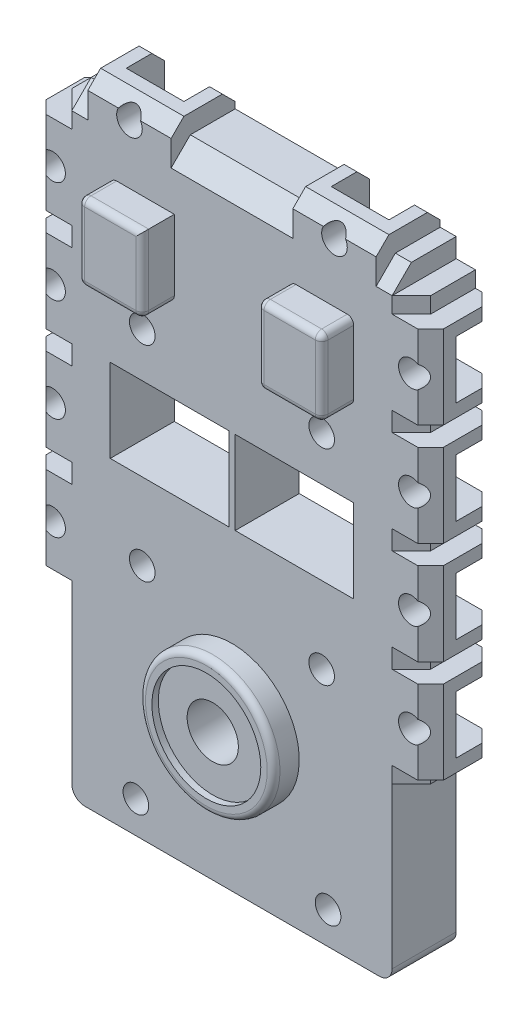
from build123d import *

# Parameters (mm, degrees)
BOSS_EXTRUDE1_DEPTH       = 5
BOSS_EXTRUDE2_DEPTH       = 1
SKETCH3_R                 = 5.25
SKETCH3_R_2               = 2
BOSS_EXTRUDE3_DEPTH       = 2
SKETCH4_R                 = 4.25
CUT_EXTRUDE1_DEPTH        = 0.5
FILLET3_R                 = 0.5
CUT_EXTRUDE2_START        = -11.5
SKETCH5_R                 = 2
CUT_EXTRUDE2_DEPTH        = 11.5
SKETCH6_W                 = 1.5
SKETCH6_H                 = 33
BOSS_EXTRUDE4_DEPTH       = 5
CUT_EXTRUDE3_DEPTH        = 61
SKETCH8_W                 = 3
SKETCH8_H                 = 6.5
SKETCH8_R                 = 1
BOSS_EXTRUDE5_DEPTH       = 5
CUT_EXTRUDE4_DEPTH        = 31
SKETCH10_R                = 1
CUT_EXTRUDE5_DEPTH        = 31
BOSS_EXTRUDE11_DEPTH      = 5
CUT_EXTRUDE6_DEPTH        = 25
SKETCH13_W                = 6.5
SKETCH13_H                = 3
SKETCH13_R                = 1
BOSS_EXTRUDE12_DEPTH      = 5
SKETCH15_R                = 1
CUT_EXTRUDE7_DEPTH        = 5
CUT_EXTRUDE8_DEPTH        = 23
CUT_EXTRUDE10_START       = -3
CUT_EXTRUDE10_OUTLINE_W   = 4.5
CUT_EXTRUDE10_OUTLINE_H   = 3
CUT_EXTRUDE10_OUTLINE_H_2 = 2
CUT_EXTRUDE10_DEPTH       = 3
SKETCH18_W                = 3
SKETCH18_H                = 4.5
CUT_EXTRUDE11_DEPTH       = 3
SKETCH19_W                = 4.5
SKETCH19_H                = 1
CUT_EXTRUDE12_DEPTH       = 3
SKETCH20_W                = 1
SKETCH20_H                = 4.5
SKETCH20_W_2              = 3
CUT_EXTRUDE13_DEPTH       = 3
SKETCH21_W                = 5
SKETCH21_H                = 6
BOSS_EXTRUDE13_DEPTH      = 2.5
FILLET4_R                 = 0.5
SKETCH22_R                = 1
SKETCH22_W                = 9.25
SKETCH22_H                = 6.5
CUT_EXTRUDE14_DEPTH       = 14.5


# Read off the part's stored shape, not the designer's step: Cut-Extrude10
with BuildPart() as part:
    # Sketch1 → Boss-Extrude1 (new body)
    with BuildSketch(Plane.XY):
        with BuildLine():
            Line((18.25, 1.5), (18.25, 0))
            Line((18.25, 0), (24, 0))
            ThreePointArc((24, 0), (24.707106781, -0.292893219), (25, -1))
            Line((25, -1), (25, -45.5))
            ThreePointArc((25, -45.5), (24.707106781, -46.207106781), (24, -46.5))
            Line((24, -46.5), (1, -46.5))
            ThreePointArc((1, -46.5), (0.292893219, -46.207106781), (0, -45.5))
            Line((0, -45.5), (0, -1))
            ThreePointArc((0, -1), (0.292893219, -0.292893219), (1, 0))
            Line((1, 0), (6.75, 0))
            Line((6.75, 0), (6.75, 1.5))
            Line((6.75, 1.5), (18.25, 1.5))
        make_face()
    extrude(amount=BOSS_EXTRUDE1_DEPTH)

    # Sketch2 → Boss-Extrude2 (add)
    with BuildSketch(Plane(origin=(0, 0, 0), x_dir=(-1, 0, 0), z_dir=(0, 0, -1))):
        with BuildLine():
            Line((-24, -2), (-24, -44.5))
            ThreePointArc((-24, -44.5), (-23.707106781, -45.207106781), (-23, -45.5))
            Line((-23, -45.5), (-2, -45.5))
            ThreePointArc((-2, -45.5), (-1.292893219, -45.207106781), (-1, -44.5))
            Line((-1, -44.5), (-1, -2))
            ThreePointArc((-1, -2), (-1.292893219, -1.292893219), (-2, -1))
            Line((-2, -1), (-23, -1))
            ThreePointArc((-23, -1), (-23.707106781, -1.292893219), (-24, -2))
        make_face()
        with BuildLine():
            Line((-23, -3), (-23, -43.5))
            ThreePointArc((-23, -43.5), (-22.707106781, -44.207106781), (-22, -44.5))
            Line((-22, -44.5), (-3, -44.5))
            ThreePointArc((-3, -44.5), (-2.292893219, -44.207106781), (-2, -43.5))
            Line((-2, -43.5), (-2, -3))
            ThreePointArc((-2, -3), (-2.292893219, -2.292893219), (-3, -2))
            Line((-3, -2), (-22, -2))
            ThreePointArc((-22, -2), (-22.707106781, -2.292893219), (-23, -3))
        make_face(mode=Mode.SUBTRACT)
    extrude(amount=BOSS_EXTRUDE2_DEPTH)

    # Sketch3 → Boss-Extrude3 (add)
    with BuildSketch(Plane.XY.offset(5)):
        with Locations(Location((12.5, -35, 0), (0, 0, 180))):
            Circle(SKETCH3_R)
        with Locations((12.5, -35)):
            Circle(SKETCH3_R_2, mode=Mode.SUBTRACT)
    extrude(amount=BOSS_EXTRUDE3_DEPTH)

    # Sketch4 → Cut-Extrude1 (cut)
    with BuildSketch(Plane.XY.offset(7)):
        with Locations((12.5, -35)):
            Circle(SKETCH4_R)
    extrude(amount=-CUT_EXTRUDE1_DEPTH, mode=Mode.SUBTRACT)

    # Fillet3
    fillet3_edges = [part.edges().sort_by_distance(p)[0] for p in [
        (17.75, -35, 7),
    ]]
    fillet(fillet3_edges, radius=FILLET3_R)

    # Sketch5 → Cut-Extrude2 (cut)
    with BuildSketch(Plane.XY.offset(5).offset(CUT_EXTRUDE2_START)):
        with Locations(Location((12.5, -35, 0), (0, 0, 180))):
            Circle(SKETCH5_R)
    extrude(amount=CUT_EXTRUDE2_DEPTH, mode=Mode.SUBTRACT)

    # Sketch6 → Boss-Extrude4 (add)
    with BuildSketch(Plane.XY.offset(5)):
        with Locations((25.75, -16.5)):
            Rectangle(SKETCH6_W, SKETCH6_H)
        with Locations((-0.75, -16.5)):
            Rectangle(SKETCH6_W, SKETCH6_H)
    extrude(amount=-BOSS_EXTRUDE4_DEPTH)

    # Sketch7 → Cut-Extrude3 (cut)
    with BuildSketch(Plane(origin=(0, 0, 0), x_dir=(-1, 0, 0), z_dir=(0, 1, 0))):
        Polygon((-26.5, 3.5), (-25, 5), (-26.5, 5), align=None)
        Polygon((1.5, 3.5), (0, 5), (1.5, 5), align=None)
    extrude(amount=-CUT_EXTRUDE3_DEPTH, mode=Mode.SUBTRACT)

    # Sketch8 → Boss-Extrude5 (add)
    # profile 1 of 8: a face of its own
    with BuildSketch(Plane.XY.offset(5)):
        with Locations((26.5, -28.5)):
            Rectangle(SKETCH8_W, SKETCH8_H)
        with Locations((26.5, -28.5)):
            Circle(SKETCH8_R, mode=Mode.SUBTRACT)
    # profile 2 of 8: a face of its own
    with BuildSketch(Plane.XY.offset(5)):
        with Locations((26.5, -20.5)):
            Rectangle(SKETCH8_W, SKETCH8_H)
        with Locations((26.5, -20.5)):
            Circle(SKETCH8_R, mode=Mode.SUBTRACT)
    # profile 3 of 8: a face of its own
    with BuildSketch(Plane.XY.offset(5)):
        with Locations((26.5, -12.5)):
            Rectangle(SKETCH8_W, SKETCH8_H)
        with Locations((26.5, -12.5)):
            Circle(SKETCH8_R, mode=Mode.SUBTRACT)
    # profile 4 of 8: a face of its own
    with BuildSketch(Plane.XY.offset(5)):
        with Locations((26.5, -4.5)):
            Rectangle(SKETCH8_W, SKETCH8_H)
        with Locations((26.5, -4.5)):
            Circle(SKETCH8_R, mode=Mode.SUBTRACT)
    # profile 5 of 8: a face of its own
    with BuildSketch(Plane.XY.offset(5)):
        with Locations((-1.5, -4.5)):
            Rectangle(SKETCH8_W, SKETCH8_H)
        with Locations(Location((-1.5, -4.5, 0), (0, 0, 90))):
            Circle(SKETCH8_R, mode=Mode.SUBTRACT)
    # profile 6 of 8: a face of its own
    with BuildSketch(Plane.XY.offset(5)):
        with Locations((-1.5, -12.5)):
            Rectangle(SKETCH8_W, SKETCH8_H)
        with Locations(Location((-1.5, -12.5, 0), (0, 0, 90))):
            Circle(SKETCH8_R, mode=Mode.SUBTRACT)
    # profile 7 of 8: a face of its own
    with BuildSketch(Plane.XY.offset(5)):
        with Locations((-1.5, -20.5)):
            Rectangle(SKETCH8_W, SKETCH8_H)
        with Locations(Location((-1.5, -20.5, 0), (0, 0, 90))):
            Circle(SKETCH8_R, mode=Mode.SUBTRACT)
    # profile 8 of 8: a face of its own
    with BuildSketch(Plane.XY.offset(5)):
        with Locations((-1.5, -28.5)):
            Rectangle(SKETCH8_W, SKETCH8_H)
        with Locations(Location((-1.5, -28.5, 0), (0, 0, 90))):
            Circle(SKETCH8_R, mode=Mode.SUBTRACT)
    extrude(amount=-BOSS_EXTRUDE5_DEPTH)

    # Sketch9 → Cut-Extrude4 (cut)
    with BuildSketch(Plane(origin=(0, -1.25, 0), x_dir=(-1, 0, 0), z_dir=(0, 1, 0))):
        Polygon((2, 5), (3, 4), (3, 5), align=None)
        Polygon((3, 1), (3, 0), (2, 0), align=None)
        Polygon((-27, 0), (-28, 0), (-28, 1), align=None)
        Polygon((-27, 5), (-28, 5), (-28, 4), align=None)
    extrude(amount=-CUT_EXTRUDE4_DEPTH, mode=Mode.SUBTRACT)

    # Sketch10 → Cut-Extrude5 (cut)
    with BuildSketch(Plane.XY.offset(5)):
        with Locations(Location((26.5, -28.5, 0), (0, 0, 300))):
            Circle(SKETCH10_R)
        with Locations(Location((26.5, -20.5, 0), (0, 0, 300))):
            Circle(SKETCH10_R)
        with Locations(Location((26.5, -12.5, 0), (0, 0, 300))):
            Circle(SKETCH10_R)
        with Locations(Location((26.5, -4.5, 0), (0, 0, 300))):
            Circle(SKETCH10_R)
        with Locations(Location((-1.5, -4.5, 0), (0, 0, 120))):
            Circle(SKETCH10_R)
        with Locations(Location((-1.5, -12.5, 0), (0, 0, 240))):
            Circle(SKETCH10_R)
        with Locations(Location((-1.5, -20.5, 0), (0, 0, 240))):
            Circle(SKETCH10_R)
        with Locations(Location((-1.5, -28.5, 0), (0, 0, 120))):
            Circle(SKETCH10_R)
    extrude(amount=-CUT_EXTRUDE5_DEPTH, mode=Mode.SUBTRACT)

    # Sketch11 → Boss-Extrude11 (add)
    with BuildSketch(Plane.XY.offset(5)):
        Polygon((25, 1.5), (0, 1.5), (0, 0), (0, -1.25), (25, -1.25), (25, 0), align=None)
    extrude(amount=-BOSS_EXTRUDE11_DEPTH)

    # Sketch12 → Cut-Extrude6 (cut)
    with BuildSketch(Plane.ZY):
        Polygon((3.5, 1.5), (5, 0), (5, 1.5), align=None)
    extrude(amount=-CUT_EXTRUDE6_DEPTH, mode=Mode.SUBTRACT)

    # Sketch13 → Boss-Extrude12 (add)
    # profile 1 of 2: a face of its own
    with BuildSketch(Plane.XY.offset(5)):
        with Locations((4.5, 1.5)):
            Rectangle(SKETCH13_W, SKETCH13_H)
        with Locations((4.5, 1.5)):
            Circle(SKETCH13_R, mode=Mode.SUBTRACT)
    # profile 2 of 2: a face of its own
    with BuildSketch(Plane.XY.offset(5)):
        with Locations((20.5, 1.5)):
            Rectangle(SKETCH13_W, SKETCH13_H)
        with Locations((20.5, 1.5)):
            Circle(SKETCH13_R, mode=Mode.SUBTRACT)
    extrude(amount=-BOSS_EXTRUDE12_DEPTH)

    # Sketch15 → Cut-Extrude7 (cut)
    with BuildSketch(Plane.XY.offset(5)):
        with Locations((4.5, 1.5)):
            Circle(SKETCH15_R)
        with Locations((20.5, 1.5)):
            Circle(SKETCH15_R)
    extrude(amount=-CUT_EXTRUDE7_DEPTH, mode=Mode.SUBTRACT)

    # Sketch16 → Cut-Extrude8 (cut)
    with BuildSketch(Plane(origin=(23.75, 0, 0), x_dir=(0, 0, -1), z_dir=(1, 0, 0))):
        Polygon((-4, 3), (-5, 2), (-5, 3), align=None)
        Polygon((-1, 3), (0, 3), (0, 2), align=None)
    extrude(amount=-CUT_EXTRUDE8_DEPTH, mode=Mode.SUBTRACT)

    # Cut-Extrude10 outline → Cut-Extrude10 (cut)
    with BuildSketch(Plane(origin=(0, 3, 0), x_dir=(-1, 0, 0), z_dir=(0, 1, 0)).offset(CUT_EXTRUDE10_START)):
        with Locations((-20.5, 1.5)):
            Rectangle(CUT_EXTRUDE10_OUTLINE_W, CUT_EXTRUDE10_OUTLINE_H)
        with Locations((-4.5, 2)):
            Rectangle(CUT_EXTRUDE10_OUTLINE_W, CUT_EXTRUDE10_OUTLINE_H_2)
    extrude(amount=CUT_EXTRUDE10_DEPTH, mode=Mode.SUBTRACT)

    # Sketch18 → Cut-Extrude11 (cut)
    with BuildSketch(Plane.ZY.offset(3)):
        with Locations((1.5, -4.5)):
            Rectangle(SKETCH18_W, SKETCH18_H)
        with Locations((1.5, -12.5)):
            Rectangle(SKETCH18_W, SKETCH18_H)
        with Locations((1.5, -20.5)):
            Rectangle(SKETCH18_W, SKETCH18_H)
        with Locations((1.5, -28.5)):
            Rectangle(SKETCH18_W, SKETCH18_H)
    extrude(amount=-CUT_EXTRUDE11_DEPTH, mode=Mode.SUBTRACT)

    # Sketch19 → Cut-Extrude12 (cut)
    with BuildSketch(Plane(origin=(0, 3, 0), x_dir=(-1, 0, 0), z_dir=(0, 1, 0))):
        with Locations((-4.5, 0.5)):
            Rectangle(SKETCH19_W, SKETCH19_H)
    extrude(amount=-CUT_EXTRUDE12_DEPTH, mode=Mode.SUBTRACT)

    # Sketch20 → Cut-Extrude13 (cut)
    with BuildSketch(Plane(origin=(28, 0, 0), x_dir=(0, 0, -1), z_dir=(1, 0, 0))):
        Polygon((-3, -10.25), (-3, -14.75), (-2, -14.75), (0, -14.75), (0, -10.25), (-2, -10.25), align=None)
        Polygon((-3, -18.25), (-3, -22.75), (-2, -22.75), (0, -22.75), (0, -18.25), (-2, -18.25), align=None)
        Polygon((-3, -26.25), (-3, -30.75), (-2, -30.75), (-1, -30.75), (-1, -26.25), (-2, -26.25), align=None)
        with Locations((-0.5, -28.5)):
            Rectangle(SKETCH20_W, SKETCH20_H)
        with Locations((-1.5, -4.5)):
            Rectangle(SKETCH20_W_2, SKETCH20_H)
    extrude(amount=-CUT_EXTRUDE13_DEPTH, mode=Mode.SUBTRACT)

    # Sketch21 → Boss-Extrude13 (add)
    with BuildSketch(Plane.XY.offset(5)):
        with Locations((19.5, -6)):
            Rectangle(SKETCH21_W, SKETCH21_H)
        with Locations((5.5, -6)):
            Rectangle(SKETCH21_W, SKETCH21_H)
    extrude(amount=BOSS_EXTRUDE13_DEPTH)

    # Fillet4
    fillet4_edges = [part.edges().sort_by_distance(p)[0] for p in [
        (22, -9, 6.25),
        (22, -3, 6.25),
        (17, -3, 6.25),
        (17, -9, 6.25),
        (22, -6, 7.5),
        (19.5, -3, 7.5),
        (17, -6, 7.5),
        (19.5, -9, 7.5),
        (3, -9, 6.25),
        (8, -9, 6.25),
        (3, -3, 6.25),
        (5.5, -9, 7.5),
        (8, -6, 7.5),
        (5.5, -3, 7.5),
        (3, -6, 7.5),
    ]]
    fillet(fillet4_edges, radius=FILLET4_R)

    # Sketch22 → Cut-Extrude14 (cut)
    with BuildSketch(Plane.XY.offset(5)):
        with Locations((19.5, -12)):
            Circle(SKETCH22_R)
        with Locations((5.5, -12)):
            Circle(SKETCH22_R)
        with Locations((19.5, -28)):
            Circle(SKETCH22_R)
        with Locations((5.5, -28)):
            Circle(SKETCH22_R)
        with Locations((20, -44)):
            Circle(SKETCH22_R)
        with Locations(Location((5, -44, 0), (0, 0, 330))):
            Circle(SKETCH22_R)
        with Locations((7.625, -18.75)):
            Rectangle(SKETCH22_W, SKETCH22_H)
        with Locations((17.375, -18.75)):
            Rectangle(SKETCH22_W, SKETCH22_H)
    extrude(amount=-CUT_EXTRUDE14_DEPTH, mode=Mode.SUBTRACT)


solid = part.part
